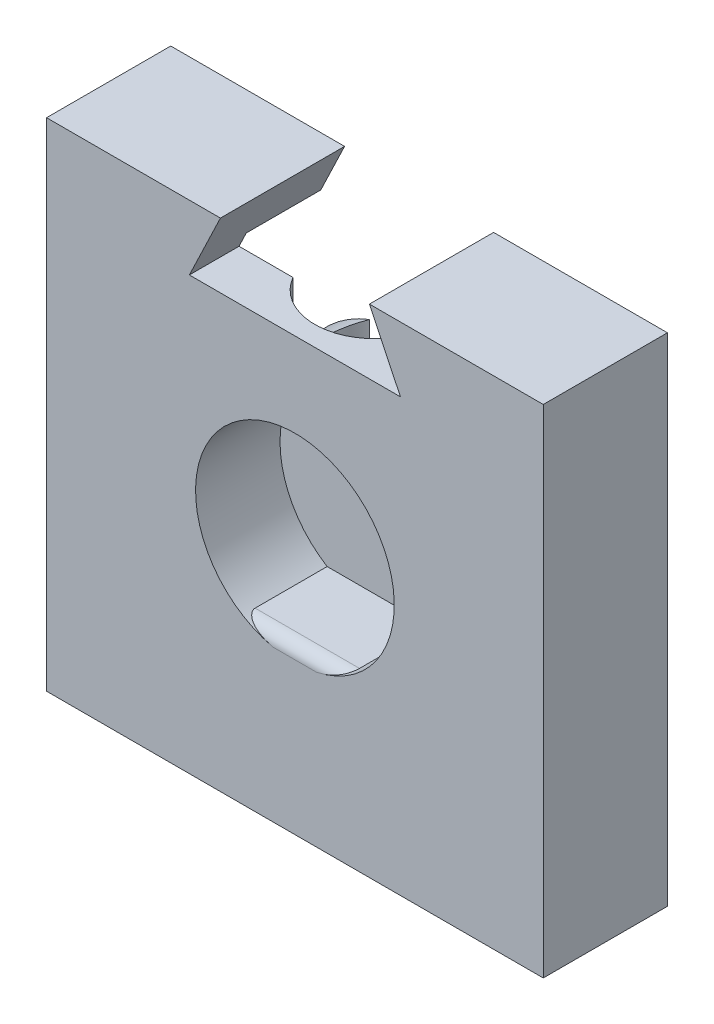
from build123d import *

# Parameters (mm, degrees)
SKETCH2_W           = 200
SKETCH2_H           = 200
BOSS_EXTRUDE1_DEPTH = 50
SHELL1_T            = -20
CUT_EXTRUDE1_DEPTH  = 50
SKETCH5_R           = 50
BOSS_EXTRUDE2_DEPTH = 28
SKETCH6_R           = 40
CUT_EXTRUDE2_DEPTH  = 34
SKETCH7_R           = 24
CUT_EXTRUDE4_DEPTH  = 50
SKETCH8_W           = 42.046967474
SKETCH8_H           = 10
BOSS_EXTRUDE3_DEPTH = 34
FILLET2_R           = 5


with BuildPart() as part:
    # Sketch2 → Boss-Extrude1 (new body)
    with BuildSketch(Plane.XY):
        with Locations((-40.678946788, -125.067928938)):
            Rectangle(SKETCH2_W, SKETCH2_H)
    extrude(amount=-BOSS_EXTRUDE1_DEPTH)

    # Shell1
    shell1_openings = [part.faces().sort_by_distance(p)[0] for p in [
        (-40.678946788, -125.067928938, -50),
    ]]
    offset(amount=SHELL1_T, openings=shell1_openings, kind=Kind.INTERSECTION)

    # Sketch3 → Cut-Extrude1 (cut)
    with BuildSketch(Plane.XY):
        Polygon((-10.678946788, -25.067928938), (1.821053212, -51.157579637), (-83.178946788, -51.157579637), (-70.678946788, -25.067928938), align=None)
    extrude(amount=-CUT_EXTRUDE1_DEPTH, mode=Mode.SUBTRACT)

    # Sketch5 → Boss-Extrude2 (add)
    with BuildSketch(Plane(origin=(0, 0, -20), x_dir=(-1, 0, 0), z_dir=(0, 0, -1))):
        with Locations((40.678946788, -125.067928938)):
            Circle(SKETCH5_R)
    extrude(amount=BOSS_EXTRUDE2_DEPTH)

    # Sketch6 → Cut-Extrude2 (cut)
    with BuildSketch(Plane.XY):
        with Locations((-40.678946788, -125.067928938)):
            Circle(SKETCH6_R)
    extrude(amount=-CUT_EXTRUDE2_DEPTH, mode=Mode.SUBTRACT)

    # Sketch7 → Cut-Extrude4 (cut)
    with BuildSketch(Plane(origin=(0, -45.067928938, 0), x_dir=(-1, 0, 0), z_dir=(0, -1, 0))):
        with Locations((40.678946788, 32)):
            Circle(SKETCH7_R)
    extrude(amount=CUT_EXTRUDE4_DEPTH, mode=Mode.SUBTRACT)

    # Sketch8 → Boss-Extrude3 (add)
    with BuildSketch(Plane.XY.offset(-34)):
        with Locations((-40.678946788, -164.097520936)):
            Rectangle(SKETCH8_W, SKETCH8_H)
    extrude(amount=BOSS_EXTRUDE3_DEPTH)

    # Fillet2
    fillet2_edges = [part.edges().sort_by_distance(p)[0] for p in [
        (-40.678946788, -159.097520936, 0),
    ]]
    fillet(fillet2_edges, radius=FILLET2_R)


solid = part.part
